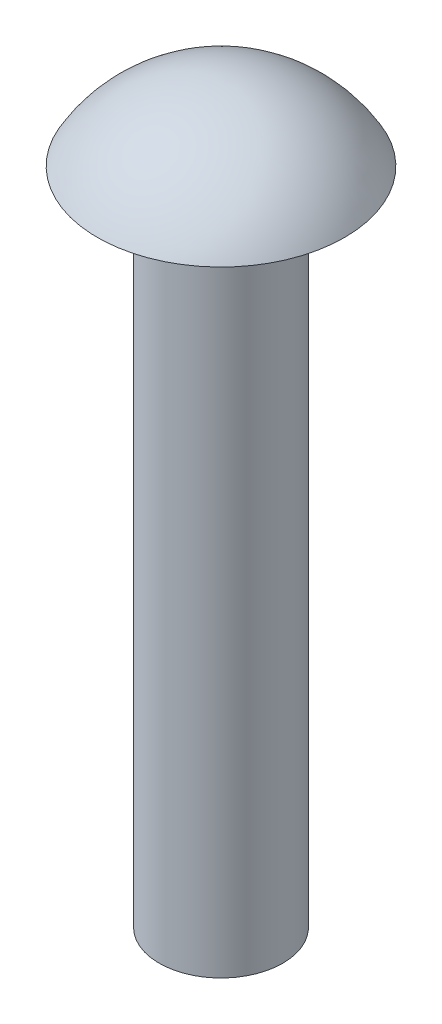
from build123d import *

# Parameters (mm, degrees)
SKETCH2_R           = 1.5
BOSS_EXTRUDE1_DEPTH = 16


with BuildPart() as part:
    # Sketch1 → Revolve1 (revolve)
    with BuildSketch(Plane.XY):
        with BuildLine():
            Line((0, 0), (0, 1.75))
            ThreePointArc((0, 1.75), (1.736555499, 1.280523712), (3, 0))
            Line((3, 0), (0, 0))
        make_face()
    revolve(axis=Axis((0, -1000, 0), (0, 1, 0)))

    # Sketch2 → Boss-Extrude1 (add)
    with BuildSketch(Plane.XZ):
        Circle(SKETCH2_R)
    extrude(amount=BOSS_EXTRUDE1_DEPTH)


solid = part.part
